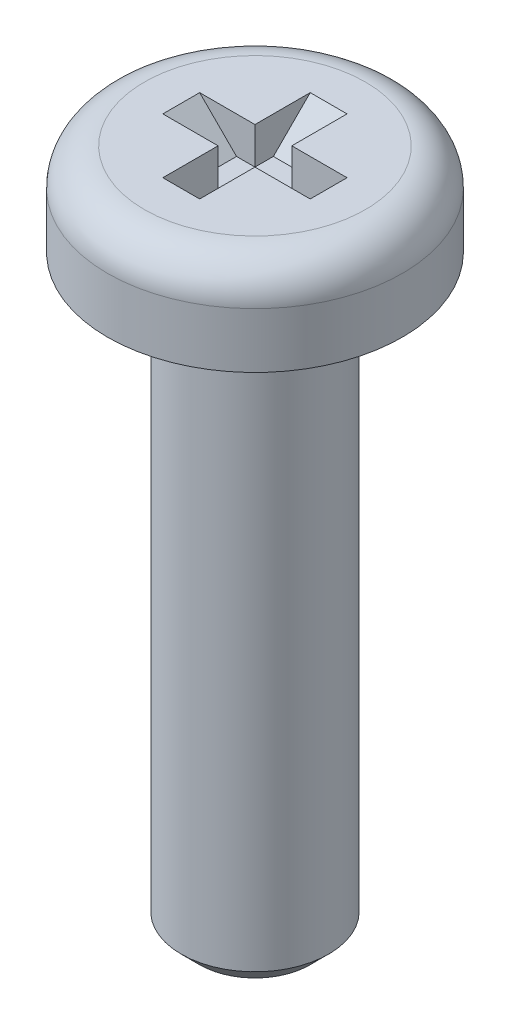
from build123d import *

# Parameters (mm, degrees)
SKETCH_1_R          = 2
EXTRUDE_1_DEPTH     = 16
SKETCH_2_R          = 4
EXTRUDE_2_DEPTH     = 2.5
FILLET_1_R          = 1
CHAMFER_1_SIZE      = 0.5
SKETCH_3_W          = 4
SKETCH_3_H          = 1
SKETCH_3_W_2        = 1
SKETCH_3_H_2        = 4
CUT_EXTRUDE_1_DEPTH = 1
CHAMFER_2_SIZE      = 1


with BuildPart() as part:
    # 草图1 → 凸台-拉伸1 (new body)
    with BuildSketch(Plane(origin=(0, 0, 0), x_dir=(1, 0, 0), z_dir=(0, 1, 0))):
        with Locations(Location((0, 0, 0), (0, 0, 270))):
            Circle(SKETCH_1_R)
    extrude(amount=EXTRUDE_1_DEPTH)

    # 草图2 → 凸台-拉伸2 (add)
    with BuildSketch(Plane(origin=(0, 16, 0), x_dir=(1, 0, 0), z_dir=(0, 1, 0))):
        with Locations(Location((0, 0, 0), (0, 0, 270))):
            Circle(SKETCH_2_R)
    extrude(amount=EXTRUDE_2_DEPTH)

    # 圆角1
    fillet_1_edges = [part.edges().sort_by_distance(p)[0] for p in [
        (0, 18.5, -4),
    ]]
    fillet(fillet_1_edges, radius=FILLET_1_R)

    # 倒角1
    chamfer_1_edges = [part.edges().sort_by_distance(p)[0] for p in [
        (0, 0, -2),
    ]]
    chamfer(chamfer_1_edges, length=CHAMFER_1_SIZE)

    # 草图3 → 切除-拉伸-薄壁1 (cut)
    with BuildSketch(Plane(origin=(0, 18.5, 0), x_dir=(1, 0, 0), z_dir=(0, 1, 0))):
        Rectangle(SKETCH_3_W, SKETCH_3_H)
        Rectangle(SKETCH_3_W_2, SKETCH_3_H_2)
    extrude(amount=-CUT_EXTRUDE_1_DEPTH, mode=Mode.SUBTRACT)

    # 倒角2
    chamfer_2_edges = [part.edges().sort_by_distance(p)[0] for p in [
        (0, 17.5, 2),
        (2, 17.5, 0),
        (0, 17.5, -2),
        (-2, 17.5, 0),
    ]]
    chamfer(chamfer_2_edges, length=CHAMFER_2_SIZE - 0.0001)  # a hair under: the kernel refuses the full size


solid = part.part
